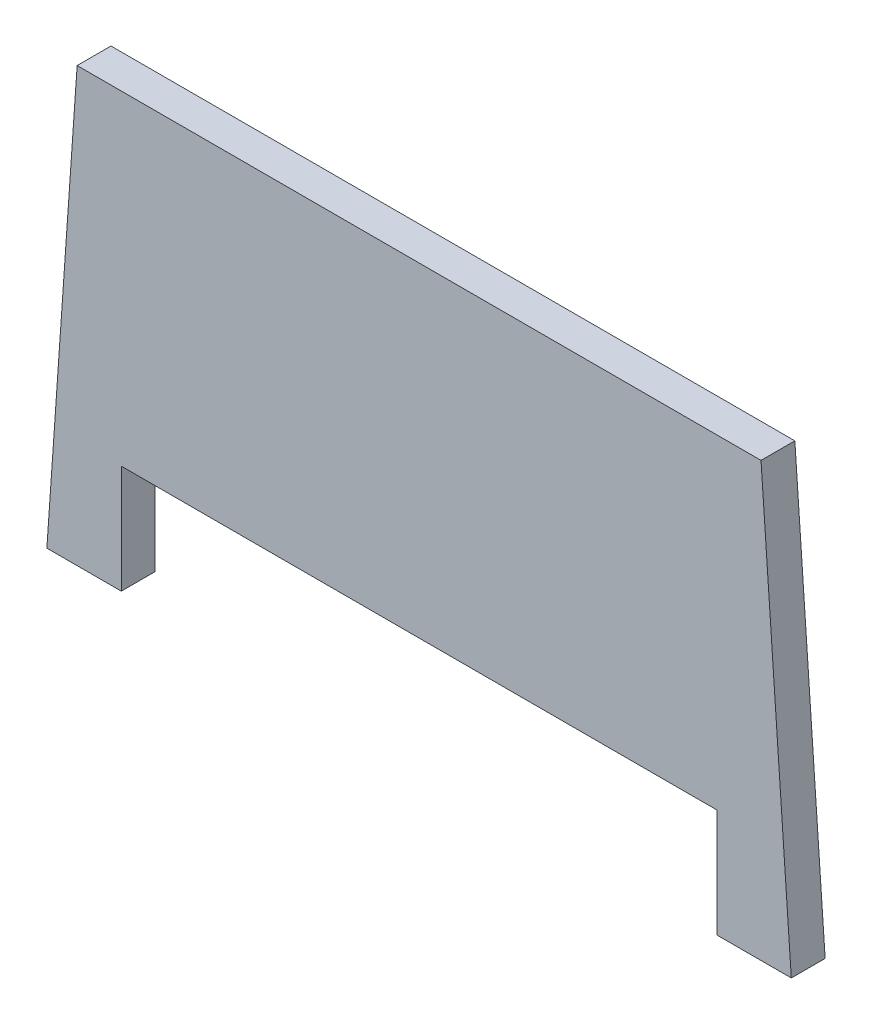
from build123d import *

# Parameters (mm, degrees)
BOSS_EXTRUDE1_DEPTH = 25
SKETCH3_W           = 80
SKETCH3_H           = 80
CUT_EXTRUDE2_DEPTH  = 681.459403638


with BuildPart() as part:
    # Sketch1 → Boss-Extrude1 (new body)
    with BuildSketch(Plane.XY):
        Polygon((50, 0), (185, 0), (185, 80), (465, 80), (465, 0), (600, 0), (577.623420178, 320), (72.376579822, 320), align=None)
    extrude(amount=BOSS_EXTRUDE1_DEPTH)

    # Sketch3 → Cut-Extrude2 (cut, through all)
    with BuildSketch(Plane.XY.offset(25)):
        with Locations((145, 40)):
            Rectangle(SKETCH3_W, SKETCH3_H)
        with Locations((505, 40)):
            Rectangle(SKETCH3_W, SKETCH3_H)
    extrude(amount=-CUT_EXTRUDE2_DEPTH, mode=Mode.SUBTRACT)


solid = part.part
